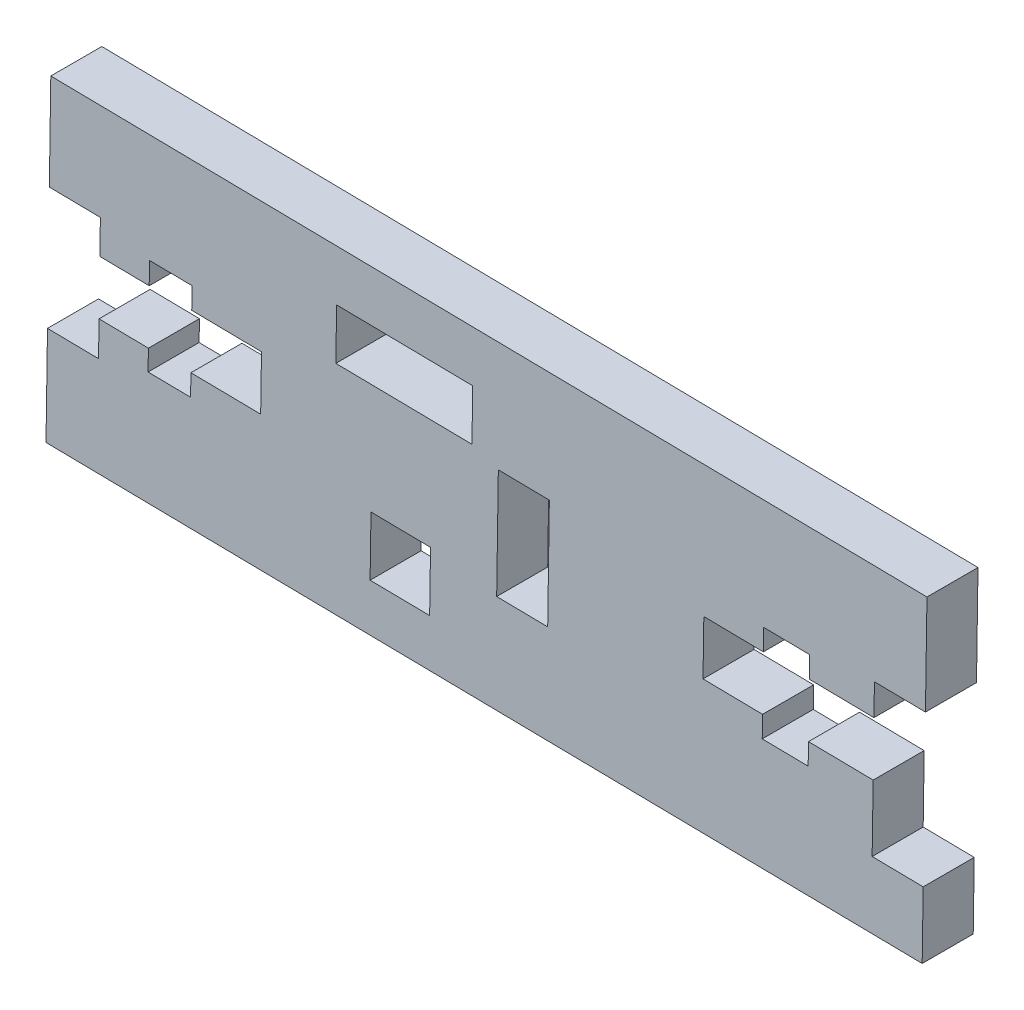
from build123d import *

# Parameters (mm, degrees)
T_LE_DE_BASE_PLI_E1_DEPTH = 3


# Sheet-metal steps are written as plain solids
with BuildPart() as part:
    # Esquisse1 → Tôle de base pliée1 (new body)
    with BuildSketch(Plane.XY):
        Polygon((56.011486003, 1451.999694839), (107.511486003, 1451.228417484), (107.423076338, 1445.325096569), (104.423412714, 1445.370020309), (104.395809304, 1443.526875799), (100.595809304, 1443.583785584), (100.614677274, 1444.843644306), (97.914677274, 1444.884080206), (97.895809304, 1443.624221484), (94.395809304, 1443.676638392), (94.347885274, 1440.476638392), (97.847885274, 1440.424221484), (97.829017303, 1439.164362762), (100.529017303, 1439.123926862), (100.547885274, 1440.383785584), (104.347885274, 1440.326875799), (104.289178337, 1436.406875799), (107.289178337, 1436.361947021), (107.230300273, 1432.430520402), (55.729627521, 1433.201807832), (55.81730132, 1439.055993264), (58.81730132, 1439.011064486), (58.847926704, 1441.055993264), (61.74760154, 1441.012566982), (61.729288791, 1439.789781712), (64.228728196, 1439.752349459), (64.247596167, 1441.012208181), (68.347416735, 1440.950808205), (68.395340765, 1444.150808205), (64.295520197, 1444.212208181), (64.314426556, 1445.474630165), (61.814987151, 1445.512062418), (61.795520197, 1444.212208181), (58.89584536, 1444.255634463), (58.92579452, 1446.255410213), (55.926130896, 1446.300333953), align=None)
        Polygon((72.811486003, 1448.747757268), (80.811486003, 1448.627947194), (80.766562262, 1445.62828357), (72.766562262, 1445.748093644), align=None, mode=Mode.SUBTRACT)
        Polygon((82.316965577, 1445.105008259), (82.219630807, 1438.605737073), (85.219294431, 1438.560813333), (85.316629201, 1445.060084519), align=None, mode=Mode.SUBTRACT)
        Polygon((74.832038551, 1439.21643164), (78.332038551, 1439.164014732), (78.279627521, 1435.664407171), (74.779627521, 1435.716824078), align=None, mode=Mode.SUBTRACT)
    extrude(amount=-T_LE_DE_BASE_PLI_E1_DEPTH)


solid = part.part
